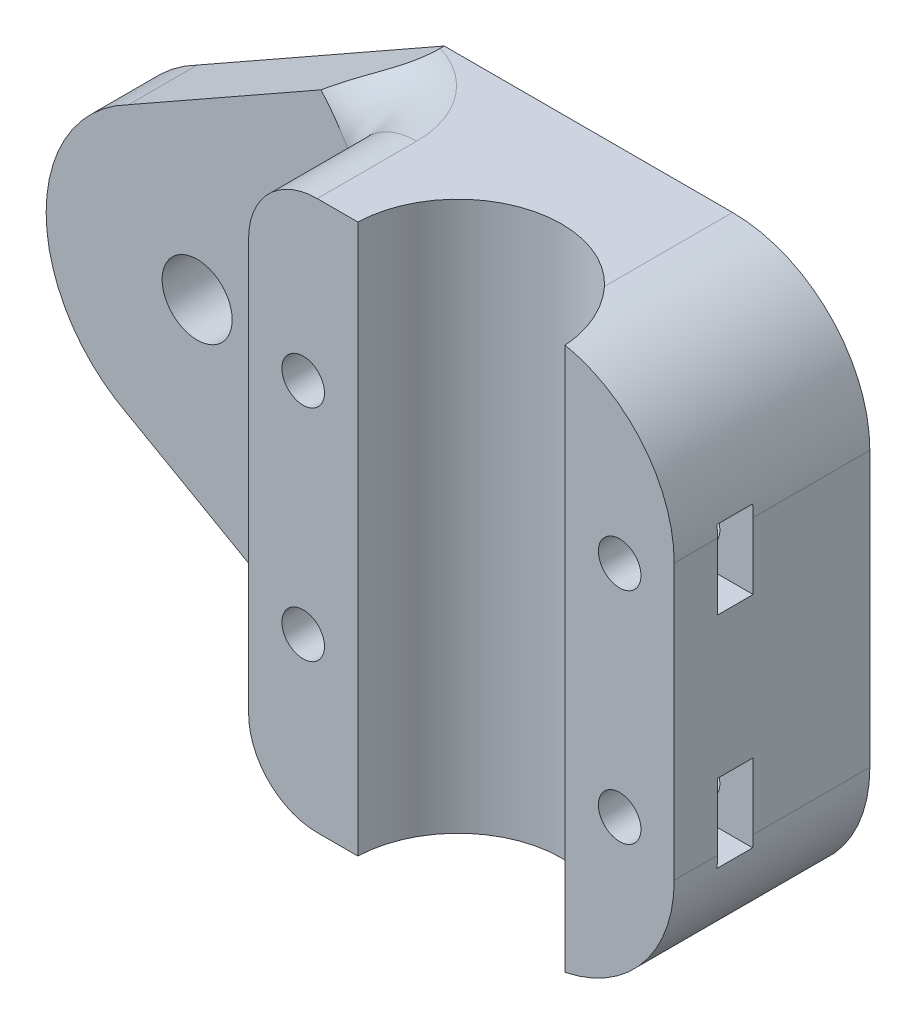
from build123d import *

# Parameters (mm, degrees)
SKETCH_3_R          = 2.55
SKETCH_3_R_2        = 1.55
EXTRUDE_1_DEPTH     = 5
SKETCH_4_R          = 1.55
EXTRUDE_2_DEPTH     = 9.25
FILLET_2_R          = 2
FILLET_START        = 6.9999999
FILLET_3_2_DEPTH    = 8.0000001
SKETCH_5_W          = 7
SKETCH_5_H          = 6
CUT_EXTRUDE_1_DEPTH = 2.6
SKETCH_6_R          = 7.55
CUT_EXTRUDE_2_DEPTH = 62.147874109
EXTRUDE_START       = 2.6
SKETCH_7_W          = 7
SKETCH_7_H          = 0.15
EXTRUDE_3_DEPTH     = 2.6


with BuildPart() as part:
    # 草图3 → 凸台-拉伸1 (new body)
    with BuildSketch(Plane.XY):
        with BuildLine():
            Line((13, 20), (-5, 9.797958971))
            ThreePointArc((-5, 9.797958971), (-11, 0), (-5, -9.797958971))
            Line((-5, -9.797958971), (13, -20))
            Line((13, -20), (34, -20))
            ThreePointArc((34, -20), (41.071067812, -17.071067812), (44, -10))
            Line((44, -10), (44, 10))
            ThreePointArc((44, 10), (41.071067812, 17.071067812), (34, 20))
            Line((34, 20), (13, 20))
        make_face()
        Circle(SKETCH_3_R, mode=Mode.SUBTRACT)
        with Locations((16.975, -8)):
            Circle(SKETCH_3_R_2, mode=Mode.SUBTRACT)
        with Locations((16.975, 8)):
            Circle(SKETCH_3_R_2, mode=Mode.SUBTRACT)
        with Locations((40.025, 8)):
            Circle(SKETCH_3_R_2, mode=Mode.SUBTRACT)
        with Locations((40.025, -8)):
            Circle(SKETCH_3_R_2, mode=Mode.SUBTRACT)
    extrude(amount=EXTRUDE_1_DEPTH)

    # 草图4 → 凸台-拉伸2 (add)
    with BuildSketch(Plane.XY.offset(5)):
        with BuildLine():
            Line((13, -15), (13, 15))
            Line((13, 15), (13, 20))
            Line((13, 20), (18, 20))
            Line((18, 20), (34, 20))
            ThreePointArc((34, 20), (41.071067812, 17.071067812), (44, 10))
            Line((44, 10), (44, -10))
            ThreePointArc((44, -10), (41.071067812, -17.071067812), (34, -20))
            Line((34, -20), (18, -20))
            Line((18, -20), (13, -20))
            Line((13, -20), (13, -15))
        make_face()
        with Locations((16.975, 8)):
            Circle(SKETCH_4_R, mode=Mode.SUBTRACT)
        with Locations((16.975, -8)):
            Circle(SKETCH_4_R, mode=Mode.SUBTRACT)
        with Locations((40.025, -8)):
            Circle(SKETCH_4_R, mode=Mode.SUBTRACT)
        with Locations((40.025, 8)):
            Circle(SKETCH_4_R, mode=Mode.SUBTRACT)
    extrude(amount=EXTRUDE_2_DEPTH)

    # 圆角2
    fillet_2_edges = [part.edges().sort_by_distance(p)[0] for p in [
        (13, 0, 5),
    ]]
    fillet(fillet_2_edges, radius=FILLET_2_R)

    # 圆角3: read off the stored shape, not the designer's step
    # 圆角3 outline → 圆角3 (revolve, cut)
    with BuildSketch(Plane(origin=(11, 0, 7), x_dir=(1, 0, 0), z_dir=(0, 0, 1))):
        with BuildLine():
            ThreePointArc((7, -20), (3.464466094, -18.535533906), (2, -15))
            Line((2, -15), (2, -20))
            Line((2, -20), (7, -20))
        make_face()
        with BuildLine():
            Line((2, 20), (2, 15))
            ThreePointArc((2, 15), (3.464466094, 18.535533906), (7, 20))
            Line((7, 20), (2, 20))
        make_face()
    revolve(axis=Axis((11, 0, 7), (0, 1, 0)), mode=Mode.SUBTRACT)

    # Fillet 3 2 outline → Fillet 3 2 (cut)
    with BuildSketch(Plane.XY.offset(FILLET_START)):
        with BuildLine():
            Line((13, -20), (18, -20))
            ThreePointArc((18, -20), (14.464466094, -18.535533906), (13, -15))
            Line((13, -15), (13, -20))
        make_face()
        with BuildLine():
            Line((13, 20), (13, 15))
            ThreePointArc((13, 15), (14.464466094, 18.535533906), (18, 20))
            Line((18, 20), (13, 20))
        make_face()
    extrude(amount=FILLET_3_2_DEPTH, mode=Mode.SUBTRACT)

    # 草图5 → 切除-拉伸1 (cut)
    with BuildSketch(Plane(origin=(0, 0, 8.5), x_dir=(-1, 0, 0), z_dir=(0, 0, -1))):
        with Locations((-40.5, 8)):
            Rectangle(SKETCH_5_W, SKETCH_5_H)
        with Locations((-40.5, -8)):
            Rectangle(SKETCH_5_W, SKETCH_5_H)
        with Locations((-16.5, -8)):
            Rectangle(SKETCH_5_W, SKETCH_5_H)
        with Locations((-16.5, 8)):
            Rectangle(SKETCH_5_W, SKETCH_5_H)
    extrude(amount=-CUT_EXTRUDE_1_DEPTH, mode=Mode.SUBTRACT)

    # 草图6 → 切除-拉伸2 (cut, through all)
    with BuildSketch(Plane.XZ.offset(20)):
        with Locations((28.5, 14.5)):
            Circle(SKETCH_6_R)
    extrude(amount=-CUT_EXTRUDE_2_DEPTH, mode=Mode.SUBTRACT)

    # 草图7 → 凸台-拉伸3 (add)
    with BuildSketch(Plane(origin=(0, 0, 11.1), x_dir=(-1, 0, 0), z_dir=(0, 0, -1)).offset(EXTRUDE_START)):
        with BuildLine():
            Line((-37, 11), (-43.949874371, 11))
            ThreePointArc((-43.949874371, 11), (-43.957124407, 10.925026241), (-43.963809512, 10.85))
            Line((-43.963809512, 10.85), (-37, 10.85))
            Line((-37, 10.85), (-37, 11))
        make_face()
        with Locations((-40.5, 5.075)):
            Rectangle(SKETCH_7_W, SKETCH_7_H)
        with Locations((-40.5, -5.075)):
            Rectangle(SKETCH_7_W, SKETCH_7_H)
        with BuildLine():
            Line((-37, -11), (-37, -10.85))
            Line((-37, -10.85), (-43.963809512, -10.85))
            ThreePointArc((-43.963809512, -10.85), (-43.957124407, -10.925026241), (-43.949874371, -11))
            Line((-43.949874371, -11), (-37, -11))
        make_face()
        with Locations((-16.5, -10.925)):
            Rectangle(SKETCH_7_W, SKETCH_7_H)
        with Locations((-16.5, -5.075)):
            Rectangle(SKETCH_7_W, SKETCH_7_H)
        with Locations((-16.5, 5.075)):
            Rectangle(SKETCH_7_W, SKETCH_7_H)
        with Locations((-16.5, 10.925)):
            Rectangle(SKETCH_7_W, SKETCH_7_H)
    extrude(amount=-EXTRUDE_3_DEPTH)


solid = part.part
